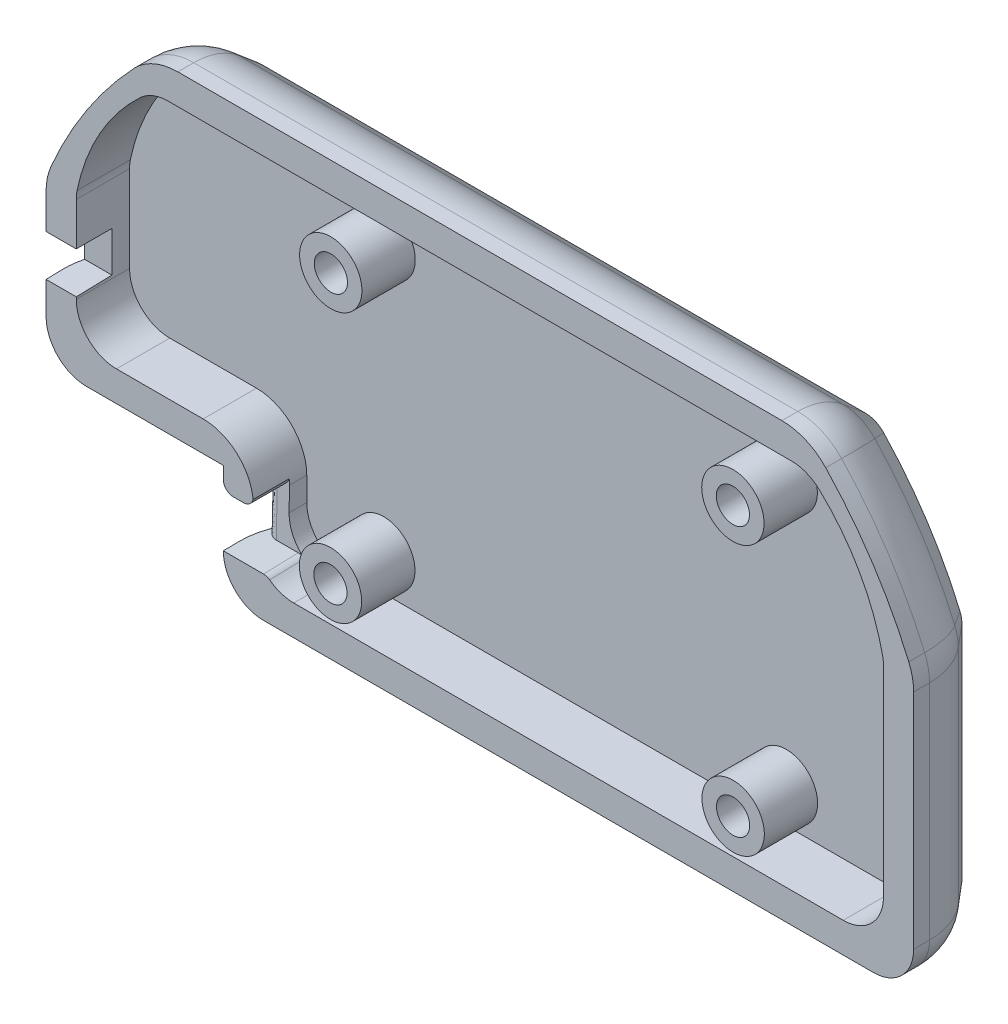
from build123d import *

# Parameters (mm, degrees)
SALIENTE_EXTRUIR1_DEPTH = 8.3
CORTAR_EXTRUIR1_DEPTH   = 5.3
REDONDEO1_R             = 4
REDONDEO2_R             = 6
CHAFL_N1_SIZE           = 3.5
CHAFL_N1_SIZE2          = 4.171137574079752
REDONDEO3_R             = 7
CROQUIS4_R              = 2.7749999999999995
CORTAR_EXTRUIR2_DEPTH   = 5
CORTAR_EXTRUIR3_DEPTH   = 5
CORTAR_EXTRUIR6_DEPTH   = 7
REDONDEO6_R             = 1
REDONDEO7_R             = 1
REDONDEO8_R             = 5
CROQUIS12_R             = 3.1
CROQUIS12_R_2           = 1.6500000000000001
CROQUIS12_R_3           = 3.100000000000001
CROQUIS12_R_4           = 3.0999999999999983
CROQUIS12_R_5           = 1.6499999999999986
SALIENTE_EXTRUIR4_DEPTH = 5.3


with BuildPart() as part:
    # Croquis2 → Saliente-Extruir1 (new body)
    with BuildSketch(Plane.XY):
        with BuildLine():
            Line((-43.60002882422233, 25.32851333445322), (-43.60002882422233, 41.3129831453771))
            ThreePointArc((-43.60002882422233, 41.3129831453771), (-39.15882671890947, 49.72881165917117), (-32.968819822944845, 56.95613898963953))
            Line((-32.968819822944845, 56.95613898963953), (32.03118017705514, 56.95613898963954))
            ThreePointArc((32.03118017705514, 56.95613898963954), (38.221187073019685, 49.72881165917111), (42.66238917833261, 41.31298314537708))
            Line((42.66238917833261, 41.31298314537708), (42.66238917833261, 25.328513334453227))
            Line((42.66238917833261, 25.328513334453227), (42.66238917833261, 13.978747509763107))
            Line((42.66238917833261, 13.978747509763107), (-25.980028824222327, 13.978747509763107))
            Line((-25.980028824222327, 13.978747509763107), (-25.980028824222327, 25.32851333445322))
            Line((-25.980028824222327, 25.32851333445322), (-43.60002882422233, 25.32851333445322))
        make_face()
    extrude(amount=SALIENTE_EXTRUIR1_DEPTH)

    # Croquis3 → Cortar-Extruir1 (cut)
    with BuildSketch(Plane.XY.offset(8.3)):
        with BuildLine():
            Line((39.66238917833264, 41.31298314537709), (39.66238917833264, 28.328513334453234))
            Line((39.66238917833264, 28.328513334453234), (39.662389178332646, 16.978747509763107))
            Line((39.662389178332646, 16.978747509763107), (-22.980028824222334, 16.978747509763107))
            Line((-22.980028824222334, 16.978747509763107), (-22.980028824222334, 28.32851333445322))
            Line((-22.980028824222334, 28.32851333445322), (-40.60002882422233, 28.32851333445322))
            Line((-40.60002882422233, 28.32851333445322), (-40.60002882422233, 41.312983145377096))
            ThreePointArc((-40.60002882422233, 41.312983145377096), (-37.935033492776, 48.32905057290172), (-32.968819822944845, 53.95613898963953))
            Line((-32.968819822944845, 53.95613898963953), (32.031180177055155, 53.95613898963953))
            ThreePointArc((32.031180177055155, 53.95613898963953), (36.96384212830244, 48.30879928595884), (39.66238917833264, 41.31298314537709))
        make_face()
    extrude(amount=-CORTAR_EXTRUIR1_DEPTH, mode=Mode.SUBTRACT)

    # Redondeo1
    redondeo1_edges = [part.edges().sort_by_distance(p)[0] for p in [
        (42.66238917833261, 13.978747509763107, 4.15),
        (-25.980028824222327, 13.978747509763107, 4.15),
        (-43.60002882422233, 25.32851333445322, 4.15),
        (-40.600028824222335, 41.312983145377096, 5.65),
        (-32.968819822944845, 53.95613898963953, 5.65),
        (32.031180177055155, 53.95613898963953, 5.65),
        (39.66238917833264, 41.31298314537709, 5.65),
        (39.662389178332646, 16.978747509763107, 5.65),
        (-22.980028824222334, 16.978747509763107, 5.65),
        (-40.60002882422233, 28.32851333445322, 5.65),
    ]]
    fillet(redondeo1_edges, radius=REDONDEO1_R)

    # Redondeo2
    redondeo2_edges = [part.edges().sort_by_distance(p)[0] for p in [
        (-43.60002882422232, 41.3129831453771, 4.15),
        (-32.968819822944845, 56.95613898963953, 4.15),
        (32.03118017705515, 56.95613898963954, 4.15),
        (42.66238917833262, 41.31298314537708, 4.15),
    ]]
    fillet(redondeo2_edges, radius=REDONDEO2_R)

    # Chaflán1
    chafl_n1_edges = [part.edges().sort_by_distance(p)[0] for p in [
        (-43.60002882422233, 34.7304792672991, 0),
        (-39.54517093838679, 49.15027772348755, 0),
        (-0.4688198229448801, 56.956138989639534, 0),
        (38.60753129249703, 49.15027772348748, 0),
        (31.934382705974894, 56.466674388389215, 0),
        (42.540408198549784, 41.33614466345175, 0),
        (-32.8720223518646, 56.46667438838922, 0),
        (-43.4780478444395, 41.33614466345178, 0),
        (42.66238917833262, 29.055596354954005, 0),
        (8.341180177055143, 13.978747509763107, 0),
        (-32.790028824222325, 25.32851333445322, 0),
        (-42.42845594896852, 26.50008620970703, 0),
        (-24.808455948968515, 15.150320385016917, 0),
        (41.4908163030788, 15.150320385016917, 0),
        (-25.980028824222327, 21.653630422108165, 0),
    ]]
    chafl_n1_side = [part.faces().sort_by_distance(p)[0] for p in [
        (1.6017428435837653, 35.75536833842062, 0),
    ]]
    chamfer(chafl_n1_edges, length=CHAFL_N1_SIZE, length2=CHAFL_N1_SIZE2, reference=chafl_n1_side[0])

    # Redondeo3
    # the kernel refuses this fillet: 7 mm, written as the material it takes off along each edge
    with BuildSketch(Plane(origin=(29.56077793282357, 50.95613898963954, 4.171137574079752), x_dir=(-5.9e-16, 1, 0), z_dir=(-1, -5.9e-16, 0))) as redondeo3_piece_1:
        with BuildLine():
            CenterArc((6 - REDONDEO3_R, -REDONDEO3_R * 0.363970234266), REDONDEO3_R, 0, 39.99999999999985)
            Line((6 - REDONDEO3_R * 0.233955556881, REDONDEO3_R * 0.27881737542), (6 - REDONDEO3_R * 0.218634668019, REDONDEO3_R * 0.291673127614))
            Line((6 - REDONDEO3_R * 0.218634668019, REDONDEO3_R * 0.291673127614), (6 + REDONDEO3_R * 0.02, REDONDEO3_R * 0.00727940468532))
            Line((6 + REDONDEO3_R * 0.02, REDONDEO3_R * 0.00727940468532), (6 + REDONDEO3_R * 0.02, -REDONDEO3_R * 0.363970234266))
            Line((6 + REDONDEO3_R * 0.02, -REDONDEO3_R * 0.363970234266), (6, -REDONDEO3_R * 0.363970234266))
        make_face()
    revolve(axis=Axis((29.56077793282357, 50.95613898963954, 4.171137574079752), (0, 0, -1)), revolution_arc=46.60689881197427, mode=Mode.SUBTRACT)
    with BuildSketch(Plane(origin=(-30.498417578713333, 56.95613898963953, 4.171137574079752), x_dir=(0, 0, 1), z_dir=(1, 2.2e-16, 0))) as redondeo3_piece_2:
        with BuildLine():
            CenterArc((REDONDEO3_R * 0.363970234266, REDONDEO3_R), REDONDEO3_R, 230.00000000000014, 39.999999999999886)
            Line((-REDONDEO3_R * 0.27881737542, REDONDEO3_R * 0.233955556881), (-REDONDEO3_R * 0.291673127614, REDONDEO3_R * 0.218634668019))
            Line((-REDONDEO3_R * 0.291673127614, REDONDEO3_R * 0.218634668019), (-REDONDEO3_R * 0.00727940468532, -REDONDEO3_R * 0.02))
            Line((-REDONDEO3_R * 0.00727940468532, -REDONDEO3_R * 0.02), (REDONDEO3_R * 0.363970234266, -REDONDEO3_R * 0.02))
            Line((REDONDEO3_R * 0.363970234266, -REDONDEO3_R * 0.02), (REDONDEO3_R * 0.363970234266, 0))
        make_face()
    extrude(amount=60.0591955115369, mode=Mode.SUBTRACT)
    with BuildSketch(Plane(origin=(-30.49841757871333, 50.95613898963953, 4.171137574079752), x_dir=(-0.726657395838407, 0.6870000211596391, 0), z_dir=(-0.6870000211596391, -0.726657395838407, 0))) as redondeo3_piece_3:
        with BuildLine():
            CenterArc((6.000000000000003 - REDONDEO3_R, -REDONDEO3_R * 0.363970234266), REDONDEO3_R, 0, 39.99999999999994)
            Line((6.000000000000003 - REDONDEO3_R * 0.233955556881, REDONDEO3_R * 0.27881737542), (6.000000000000003 - REDONDEO3_R * 0.218634668019, REDONDEO3_R * 0.291673127614))
            Line((6.000000000000003 - REDONDEO3_R * 0.218634668019, REDONDEO3_R * 0.291673127614), (6.000000000000003 + REDONDEO3_R * 0.02, REDONDEO3_R * 0.00727940468532))
            Line((6.000000000000003 + REDONDEO3_R * 0.02, REDONDEO3_R * 0.00727940468532), (6.000000000000003 + REDONDEO3_R * 0.02, -REDONDEO3_R * 0.363970234266))
            Line((6.000000000000003 + REDONDEO3_R * 0.02, -REDONDEO3_R * 0.363970234266), (6.000000000000003, -REDONDEO3_R * 0.363970234266))
        make_face()
    revolve(axis=Axis((-30.49841757871333, 50.95613898963953, 4.171137574079752), (0, 0, -1)), revolution_arc=46.60689881197317, mode=Mode.SUBTRACT)
    with BuildSketch(Plane(origin=(-3.7394013650729256, 25.657497827704482, 4.171137574079752), x_dir=(-0.9195059778908293, 0.39307601888569815, 0), z_dir=(-0.39307601888569815, -0.9195059778908293, 0))) as redondeo3_piece_4:
        with BuildLine():
            CenterArc((42.82480405056114 - REDONDEO3_R, -REDONDEO3_R * 0.363970234266), REDONDEO3_R, 0, 39.99999999999993)
            Line((42.82480405056114 - REDONDEO3_R * 0.233955556881, REDONDEO3_R * 0.27881737542), (42.82480405056114 - REDONDEO3_R * 0.218634668019, REDONDEO3_R * 0.291673127614))
            Line((42.82480405056114 - REDONDEO3_R * 0.218634668019, REDONDEO3_R * 0.291673127614), (42.82480405056114 + REDONDEO3_R * 0.02, REDONDEO3_R * 0.00727940468532))
            Line((42.82480405056114 + REDONDEO3_R * 0.02, REDONDEO3_R * 0.00727940468532), (42.82480405056114 + REDONDEO3_R * 0.02, -REDONDEO3_R * 0.363970234266))
            Line((42.82480405056114 + REDONDEO3_R * 0.02, -REDONDEO3_R * 0.363970234266), (42.82480405056114, -REDONDEO3_R * 0.363970234266))
        make_face()
    revolve(axis=Axis((-3.7394013650729256, 25.657497827704482, 4.171137574079752), (0, 0, -1)), revolution_arc=20.24706699288521, mode=Mode.SUBTRACT)
    with BuildSketch(Plane(origin=(-37.60002882422232, 40.132445200144986, 4.171137574079752), x_dir=(-1, 0, 0), z_dir=(0, -1, 0))) as redondeo3_piece_5:
        with BuildLine():
            CenterArc((6 - REDONDEO3_R, -REDONDEO3_R * 0.363970234266), REDONDEO3_R, 0, 39.99999999999985)
            Line((6 - REDONDEO3_R * 0.233955556881, REDONDEO3_R * 0.27881737542), (6 - REDONDEO3_R * 0.218634668019, REDONDEO3_R * 0.291673127614))
            Line((6 - REDONDEO3_R * 0.218634668019, REDONDEO3_R * 0.291673127614), (6 + REDONDEO3_R * 0.02, REDONDEO3_R * 0.00727940468532))
            Line((6 + REDONDEO3_R * 0.02, REDONDEO3_R * 0.00727940468532), (6 + REDONDEO3_R * 0.02, -REDONDEO3_R * 0.363970234266))
            Line((6 + REDONDEO3_R * 0.02, -REDONDEO3_R * 0.363970234266), (6, -REDONDEO3_R * 0.363970234266))
        make_face()
    revolve(axis=Axis((-37.60002882422232, 40.132445200144986, 4.171137574079752), (0, 0, -1)), revolution_arc=23.146034195141592, mode=Mode.SUBTRACT)
    with BuildSketch(Plane(origin=(-43.60002882422233, 29.32851333445322, 4.171137574079752), x_dir=(0, 0, 1), z_dir=(0, 1, 0))) as redondeo3_piece_6:
        with BuildLine():
            CenterArc((REDONDEO3_R * 0.363970234266, REDONDEO3_R), REDONDEO3_R, 230.00000000000009, 39.999999999999886)
            Line((-REDONDEO3_R * 0.27881737542, REDONDEO3_R * 0.233955556881), (-REDONDEO3_R * 0.291673127614, REDONDEO3_R * 0.218634668019))
            Line((-REDONDEO3_R * 0.291673127614, REDONDEO3_R * 0.218634668019), (-REDONDEO3_R * 0.00727940468532, -REDONDEO3_R * 0.02))
            Line((-REDONDEO3_R * 0.00727940468532, -REDONDEO3_R * 0.02), (REDONDEO3_R * 0.363970234266, -REDONDEO3_R * 0.02))
            Line((REDONDEO3_R * 0.363970234266, -REDONDEO3_R * 0.02), (REDONDEO3_R * 0.363970234266, 0))
        make_face()
    extrude(amount=10.803931865691766, mode=Mode.SUBTRACT)
    with BuildSketch(Plane(origin=(-39.60002882422233, 29.32851333445322, 4.171137574079752), x_dir=(0, -1, 0), z_dir=(1, 0, 0))) as redondeo3_piece_7:
        with BuildLine():
            CenterArc((4 - REDONDEO3_R, -REDONDEO3_R * 0.363970234266), REDONDEO3_R, 0, 39.999999999999886)
            Line((4 - REDONDEO3_R * 0.233955556881, REDONDEO3_R * 0.27881737542), (4 - REDONDEO3_R * 0.218634668019, REDONDEO3_R * 0.291673127614))
            Line((4 - REDONDEO3_R * 0.218634668019, REDONDEO3_R * 0.291673127614), (4 + REDONDEO3_R * 0.02, REDONDEO3_R * 0.00727940468532))
            Line((4 + REDONDEO3_R * 0.02, REDONDEO3_R * 0.00727940468532), (4 + REDONDEO3_R * 0.02, -REDONDEO3_R * 0.363970234266))
            Line((4 + REDONDEO3_R * 0.02, -REDONDEO3_R * 0.363970234266), (4, -REDONDEO3_R * 0.363970234266))
        make_face()
    revolve(axis=Axis((-39.60002882422233, 29.32851333445322, 4.171137574079752), (0, 0, -1)), revolution_arc=90, mode=Mode.SUBTRACT)
    with BuildSketch(Plane(origin=(-23.432237184358918, 25.32851333445322, 4.171137574079753), x_dir=(0, 0, 1), z_dir=(-1, 0, 0))) as redondeo3_piece_8_section:
        with BuildLine():
            CenterArc((REDONDEO3_R * 0.363970234266, REDONDEO3_R), REDONDEO3_R, 230.00000000000009, 39.999999999999886)
            Line((-REDONDEO3_R * 0.27881737542, REDONDEO3_R * 0.233955556881), (-REDONDEO3_R * 0.291673127614, REDONDEO3_R * 0.218634668019))
            Line((-REDONDEO3_R * 0.291673127614, REDONDEO3_R * 0.218634668019), (-REDONDEO3_R * 0.00727940468532, -REDONDEO3_R * 0.02))
            Line((-REDONDEO3_R * 0.00727940468532, -REDONDEO3_R * 0.02), (REDONDEO3_R * 0.363970234266, -REDONDEO3_R * 0.02))
            Line((REDONDEO3_R * 0.363970234266, -REDONDEO3_R * 0.02), (REDONDEO3_R * 0.363970234266, 0))
        make_face()
    redondeo3_piece_8 = extrude(amount=16.16779163986341, mode=Mode.PRIVATE)
    redondeo3_piece_8 = split(redondeo3_piece_8, bisect_by=Plane(origin=(-25.980028824222327, 26.27329503327853, 3.0060445032906005), z_dir=(1, 0, 0)), keep=Keep.TOP, mode=Mode.PRIVATE)
    redondeo3_piece_8 = split(redondeo3_piece_8, bisect_by=Plane(origin=(-25.204366068883004, 26.27329503327853, 3.2467386987625857), z_dir=(-0.7660444431189793, 0, -0.6427876096865378)), keep=Keep.TOP, mode=Mode.PRIVATE)
    add(redondeo3_piece_8, mode=Mode.SUBTRACT)
    with BuildSketch(Plane(origin=(-25.980028824222327, 25.32851333445322, 4.171137574079752), x_dir=(0, 0, 1), z_dir=(-1, 0, 0))) as redondeo3_piece_9_section:
        with BuildLine():
            CenterArc((REDONDEO3_R * 0.363970234266, REDONDEO3_R), REDONDEO3_R, 230.00000000000009, 39.999999999999886)
            Line((-REDONDEO3_R * 0.27881737542, REDONDEO3_R * 0.233955556881), (-REDONDEO3_R * 0.291673127614, REDONDEO3_R * 0.218634668019))
            Line((-REDONDEO3_R * 0.291673127614, REDONDEO3_R * 0.218634668019), (-REDONDEO3_R * 0.00727940468532, -REDONDEO3_R * 0.02))
            Line((-REDONDEO3_R * 0.00727940468532, -REDONDEO3_R * 0.02), (REDONDEO3_R * 0.363970234266, -REDONDEO3_R * 0.02))
            Line((REDONDEO3_R * 0.363970234266, -REDONDEO3_R * 0.02), (REDONDEO3_R * 0.363970234266, 0))
        make_face()
    redondeo3_piece_9 = extrude(amount=13.620000000000001, mode=Mode.PRIVATE)
    redondeo3_piece_9 = split(redondeo3_piece_9, bisect_by=Plane(origin=(-26.947574554728, 25.317678328783646, 5.324213674409082), z_dir=(0.7660444431189793, 0, 0.6427876096865378)), keep=Keep.TOP, mode=Mode.PRIVATE)
    add(redondeo3_piece_9, mode=Mode.SUBTRACT)
    with BuildSketch(Plane(origin=(-25.980028824222327, 25.32851333445322, 4.171137574079752), x_dir=(0, 0, 1), z_dir=(-1, 0, 0))) as redondeo3_piece_10_section:
        with BuildLine():
            CenterArc((REDONDEO3_R * 0.363970234266, REDONDEO3_R), REDONDEO3_R, 230.00000000000009, 39.999999999999886)
            Line((-REDONDEO3_R * 0.27881737542, REDONDEO3_R * 0.233955556881), (-REDONDEO3_R * 0.291673127614, REDONDEO3_R * 0.218634668019))
            Line((-REDONDEO3_R * 0.291673127614, REDONDEO3_R * 0.218634668019), (-REDONDEO3_R * 0.00727940468532, -REDONDEO3_R * 0.02))
            Line((-REDONDEO3_R * 0.00727940468532, -REDONDEO3_R * 0.02), (REDONDEO3_R * 0.363970234266, -REDONDEO3_R * 0.02))
            Line((REDONDEO3_R * 0.363970234266, -REDONDEO3_R * 0.02), (REDONDEO3_R * 0.363970234266, 0))
        make_face()
    redondeo3_piece_10 = extrude(amount=13.620000000000001, mode=Mode.PRIVATE)
    redondeo3_piece_10 = split(redondeo3_piece_10, bisect_by=Plane(origin=(-28.91365303284747, 25.67823870114554, 7.667294764030126), z_dir=(-0.7660444431189793, 0, -0.6427876096865378)), keep=Keep.TOP, mode=Mode.PRIVATE)
    add(redondeo3_piece_10, mode=Mode.SUBTRACT)
    with BuildSketch(Plane(origin=(-25.980028824222327, 17.978747509763107, 4.171137574079752), x_dir=(0, 0, 1), z_dir=(0, 1, 0))) as redondeo3_piece_11_section:
        with BuildLine():
            CenterArc((REDONDEO3_R * 0.363970234266, REDONDEO3_R), REDONDEO3_R, 230.0000000000001, 39.999999999999886)
            Line((-REDONDEO3_R * 0.27881737542, REDONDEO3_R * 0.233955556881), (-REDONDEO3_R * 0.291673127614, REDONDEO3_R * 0.218634668019))
            Line((-REDONDEO3_R * 0.291673127614, REDONDEO3_R * 0.218634668019), (-REDONDEO3_R * 0.00727940468532, -REDONDEO3_R * 0.02))
            Line((-REDONDEO3_R * 0.00727940468532, -REDONDEO3_R * 0.02), (REDONDEO3_R * 0.363970234266, -REDONDEO3_R * 0.02))
            Line((REDONDEO3_R * 0.363970234266, -REDONDEO3_R * 0.02), (REDONDEO3_R * 0.363970234266, 0))
        make_face()
    redondeo3_piece_11 = extrude(amount=7.349765824690113, mode=Mode.PRIVATE)
    redondeo3_piece_11 = split(redondeo3_piece_11, bisect_by=Plane(origin=(-25.62050052509104, 23.713289919136134, 6.096085882126184), z_dir=(0, -0.7660444431189793, -0.6427876096865378)), keep=Keep.TOP, mode=Mode.PRIVATE)
    add(redondeo3_piece_11, mode=Mode.SUBTRACT)
    with BuildSketch(Plane(origin=(-25.980028824222327, 17.978747509763107, 4.171137574079752), x_dir=(0, 0, 1), z_dir=(0, 1, 0))) as redondeo3_piece_12_section:
        with BuildLine():
            CenterArc((REDONDEO3_R * 0.363970234266, REDONDEO3_R), REDONDEO3_R, 230.0000000000001, 39.999999999999886)
            Line((-REDONDEO3_R * 0.27881737542, REDONDEO3_R * 0.233955556881), (-REDONDEO3_R * 0.291673127614, REDONDEO3_R * 0.218634668019))
            Line((-REDONDEO3_R * 0.291673127614, REDONDEO3_R * 0.218634668019), (-REDONDEO3_R * 0.00727940468532, -REDONDEO3_R * 0.02))
            Line((-REDONDEO3_R * 0.00727940468532, -REDONDEO3_R * 0.02), (REDONDEO3_R * 0.363970234266, -REDONDEO3_R * 0.02))
            Line((REDONDEO3_R * 0.363970234266, -REDONDEO3_R * 0.02), (REDONDEO3_R * 0.363970234266, 0))
        make_face()
    redondeo3_piece_12 = extrude(amount=9.897557464553522, mode=Mode.PRIVATE)
    redondeo3_piece_12 = split(redondeo3_piece_12, bisect_by=Plane(origin=(-25.035247125397017, 25.32851333445322, 3.006044503290602), z_dir=(0, 1, 0)), keep=Keep.TOP, mode=Mode.PRIVATE)
    redondeo3_piece_12 = split(redondeo3_piece_12, bisect_by=Plane(origin=(-25.035247125397017, 26.10417608979254, 3.246738698762591), z_dir=(0, -0.7660444431189793, -0.6427876096865378)), keep=Keep.TOP, mode=Mode.PRIVATE)
    add(redondeo3_piece_12, mode=Mode.SUBTRACT)
    with BuildSketch(Plane(origin=(-25.980028824222327, 17.978747509763107, 4.171137574079752), x_dir=(0, 0, 1), z_dir=(0, 1, 0))) as redondeo3_piece_13_section:
        with BuildLine():
            CenterArc((REDONDEO3_R * 0.363970234266, REDONDEO3_R), REDONDEO3_R, 230.0000000000001, 39.999999999999886)
            Line((-REDONDEO3_R * 0.27881737542, REDONDEO3_R * 0.233955556881), (-REDONDEO3_R * 0.291673127614, REDONDEO3_R * 0.218634668019))
            Line((-REDONDEO3_R * 0.291673127614, REDONDEO3_R * 0.218634668019), (-REDONDEO3_R * 0.00727940468532, -REDONDEO3_R * 0.02))
            Line((-REDONDEO3_R * 0.00727940468532, -REDONDEO3_R * 0.02), (REDONDEO3_R * 0.363970234266, -REDONDEO3_R * 0.02))
            Line((REDONDEO3_R * 0.363970234266, -REDONDEO3_R * 0.02), (REDONDEO3_R * 0.363970234266, 0))
        make_face()
    redondeo3_piece_13 = extrude(amount=7.349765824690113, mode=Mode.PRIVATE)
    redondeo3_piece_13 = split(redondeo3_piece_13, bisect_by=Plane(origin=(-25.990863829891904, 24.360967603947547, 5.32421367440908), z_dir=(0, 0.7660444431189793, 0.6427876096865378)), keep=Keep.TOP, mode=Mode.PRIVATE)
    add(redondeo3_piece_13, mode=Mode.SUBTRACT)
    with BuildSketch(Plane(origin=(-21.980028824222323, 17.978747509763107, 4.171137574079752), x_dir=(0, -1, 0), z_dir=(1, 0, 0))) as redondeo3_piece_14:
        with BuildLine():
            CenterArc((4 - REDONDEO3_R, -REDONDEO3_R * 0.363970234266), REDONDEO3_R, 0, 39.999999999999886)
            Line((4 - REDONDEO3_R * 0.233955556881, REDONDEO3_R * 0.27881737542), (4 - REDONDEO3_R * 0.218634668019, REDONDEO3_R * 0.291673127614))
            Line((4 - REDONDEO3_R * 0.218634668019, REDONDEO3_R * 0.291673127614), (4 + REDONDEO3_R * 0.02, REDONDEO3_R * 0.00727940468532))
            Line((4 + REDONDEO3_R * 0.02, REDONDEO3_R * 0.00727940468532), (4 + REDONDEO3_R * 0.02, -REDONDEO3_R * 0.363970234266))
            Line((4 + REDONDEO3_R * 0.02, -REDONDEO3_R * 0.363970234266), (4, -REDONDEO3_R * 0.363970234266))
        make_face()
    revolve(axis=Axis((-21.980028824222323, 17.978747509763107, 4.171137574079752), (0, 0, -1)), revolution_arc=90, mode=Mode.SUBTRACT)
    with BuildSketch(Plane(origin=(38.66238917833261, 13.978747509763107, 4.171137574079752), x_dir=(0, 0, 1), z_dir=(-1, 0, 0))) as redondeo3_piece_15:
        with BuildLine():
            CenterArc((REDONDEO3_R * 0.363970234266, REDONDEO3_R), REDONDEO3_R, 230.0000000000001, 39.999999999999886)
            Line((-REDONDEO3_R * 0.27881737542, REDONDEO3_R * 0.233955556881), (-REDONDEO3_R * 0.291673127614, REDONDEO3_R * 0.218634668019))
            Line((-REDONDEO3_R * 0.291673127614, REDONDEO3_R * 0.218634668019), (-REDONDEO3_R * 0.00727940468532, -REDONDEO3_R * 0.02))
            Line((-REDONDEO3_R * 0.00727940468532, -REDONDEO3_R * 0.02), (REDONDEO3_R * 0.363970234266, -REDONDEO3_R * 0.02))
            Line((REDONDEO3_R * 0.363970234266, -REDONDEO3_R * 0.02), (REDONDEO3_R * 0.363970234266, 0))
        make_face()
    extrude(amount=60.64241800255493, mode=Mode.SUBTRACT)
    with BuildSketch(Plane(origin=(38.66238917833261, 17.978747509763107, 4.171137574079752), x_dir=(1, 0, 0), z_dir=(0, 1, 0))) as redondeo3_piece_16:
        with BuildLine():
            CenterArc((4 - REDONDEO3_R, -REDONDEO3_R * 0.363970234266), REDONDEO3_R, 0, 39.99999999999993)
            Line((4 - REDONDEO3_R * 0.233955556881, REDONDEO3_R * 0.27881737542), (4 - REDONDEO3_R * 0.218634668019, REDONDEO3_R * 0.291673127614))
            Line((4 - REDONDEO3_R * 0.218634668019, REDONDEO3_R * 0.291673127614), (4 + REDONDEO3_R * 0.02, REDONDEO3_R * 0.00727940468532))
            Line((4 + REDONDEO3_R * 0.02, REDONDEO3_R * 0.00727940468532), (4 + REDONDEO3_R * 0.02, -REDONDEO3_R * 0.363970234266))
            Line((4 + REDONDEO3_R * 0.02, -REDONDEO3_R * 0.363970234266), (4, -REDONDEO3_R * 0.363970234266))
        make_face()
    revolve(axis=Axis((38.66238917833261, 17.978747509763107, 4.171137574079752), (0, 0, -1)), revolution_arc=90, mode=Mode.SUBTRACT)
    with BuildSketch(Plane(origin=(42.66238917833261, 40.1324452001449, 4.171137574079752), x_dir=(0, 0, 1), z_dir=(-2.6e-16, -1, 0))) as redondeo3_piece_17:
        with BuildLine():
            CenterArc((REDONDEO3_R * 0.363970234266, REDONDEO3_R), REDONDEO3_R, 230.00000000000009, 39.999999999999886)
            Line((-REDONDEO3_R * 0.27881737542, REDONDEO3_R * 0.233955556881), (-REDONDEO3_R * 0.291673127614, REDONDEO3_R * 0.218634668019))
            Line((-REDONDEO3_R * 0.291673127614, REDONDEO3_R * 0.218634668019), (-REDONDEO3_R * 0.00727940468532, -REDONDEO3_R * 0.02))
            Line((-REDONDEO3_R * 0.00727940468532, -REDONDEO3_R * 0.02), (REDONDEO3_R * 0.363970234266, -REDONDEO3_R * 0.02))
            Line((REDONDEO3_R * 0.363970234266, -REDONDEO3_R * 0.02), (REDONDEO3_R * 0.363970234266, 0))
        make_face()
    extrude(amount=22.153697690381794, mode=Mode.SUBTRACT)
    with BuildSketch(Plane(origin=(36.66238917833262, 40.1324452001449, 4.171137574079752), x_dir=(0.9195059778908227, 0.39307601888571375, 0), z_dir=(-0.39307601888571375, 0.9195059778908227, 0))) as redondeo3_piece_18:
        with BuildLine():
            CenterArc((6.000000000000002 - REDONDEO3_R, -REDONDEO3_R * 0.363970234266), REDONDEO3_R, 0, 39.999999999999886)
            Line((6.000000000000002 - REDONDEO3_R * 0.233955556881, REDONDEO3_R * 0.27881737542), (6.000000000000002 - REDONDEO3_R * 0.218634668019, REDONDEO3_R * 0.291673127614))
            Line((6.000000000000002 - REDONDEO3_R * 0.218634668019, REDONDEO3_R * 0.291673127614), (6.000000000000002 + REDONDEO3_R * 0.02, REDONDEO3_R * 0.00727940468532))
            Line((6.000000000000002 + REDONDEO3_R * 0.02, REDONDEO3_R * 0.00727940468532), (6.000000000000002 + REDONDEO3_R * 0.02, -REDONDEO3_R * 0.363970234266))
            Line((6.000000000000002 + REDONDEO3_R * 0.02, -REDONDEO3_R * 0.363970234266), (6.000000000000002, -REDONDEO3_R * 0.363970234266))
        make_face()
    revolve(axis=Axis((36.66238917833262, 40.1324452001449, 4.171137574079752), (0, 0, -1)), revolution_arc=23.146034195142526, mode=Mode.SUBTRACT)
    with BuildSketch(Plane(origin=(2.8017617191798188, 25.65749782770225, 4.171137574079752), x_dir=(0.72665739583842, 0.6870000211596253, 0), z_dir=(-0.6870000211596253, 0.72665739583842, 0))) as redondeo3_piece_19:
        with BuildLine():
            CenterArc((42.82480405056512 - REDONDEO3_R, -REDONDEO3_R * 0.363970234266), REDONDEO3_R, 0, 39.99999999999993)
            Line((42.82480405056512 - REDONDEO3_R * 0.233955556881, REDONDEO3_R * 0.27881737542), (42.82480405056512 - REDONDEO3_R * 0.218634668019, REDONDEO3_R * 0.291673127614))
            Line((42.82480405056512 - REDONDEO3_R * 0.218634668019, REDONDEO3_R * 0.291673127614), (42.82480405056512 + REDONDEO3_R * 0.02, REDONDEO3_R * 0.00727940468532))
            Line((42.82480405056512 + REDONDEO3_R * 0.02, REDONDEO3_R * 0.00727940468532), (42.82480405056512 + REDONDEO3_R * 0.02, -REDONDEO3_R * 0.363970234266))
            Line((42.82480405056512 + REDONDEO3_R * 0.02, -REDONDEO3_R * 0.363970234266), (42.82480405056511, -REDONDEO3_R * 0.363970234266))
        make_face()
    revolve(axis=Axis((2.8017617191798188, 25.65749782770225, 4.171137574079752), (0, 0, -1)), revolution_arc=20.24706699288318, mode=Mode.SUBTRACT)
    with BuildSketch(Plane(origin=(-23.432237184358918, 25.32851333445322, 4.171137574079753), x_dir=(0, 0, 1), z_dir=(-1, 0, 0))) as redondeo3_piece_20a_section:
        with BuildLine():
            CenterArc((REDONDEO3_R * 0.363970234266, REDONDEO3_R), REDONDEO3_R, 230.00000000000009, 39.999999999999886)
            Line((-REDONDEO3_R * 0.27881737542, REDONDEO3_R * 0.233955556881), (-REDONDEO3_R * 0.291673127614, REDONDEO3_R * 0.218634668019))
            Line((-REDONDEO3_R * 0.291673127614, REDONDEO3_R * 0.218634668019), (-REDONDEO3_R * 0.00727940468532, -REDONDEO3_R * 0.02))
            Line((-REDONDEO3_R * 0.00727940468532, -REDONDEO3_R * 0.02), (REDONDEO3_R * 0.363970234266, -REDONDEO3_R * 0.02))
            Line((REDONDEO3_R * 0.363970234266, -REDONDEO3_R * 0.02), (REDONDEO3_R * 0.363970234266, 0))
        make_face()
    redondeo3_piece_20a = extrude(amount=16.16779163986341, mode=Mode.PRIVATE)
    redondeo3_piece_20a = split(redondeo3_piece_20a, bisect_by=Plane(origin=(-25.980028824222327, 25.584574589836716, 4.470578982051864), z_dir=(1, 0, 0)), keep=Keep.TOP, mode=Mode.PRIVATE)
    redondeo3_piece_20a = split(redondeo3_piece_20a, bisect_by=Plane(origin=(-25.55679663997047, 25.584574589836716, 3.666749097996106), z_dir=(0.7660444431189793, 0, 0.6427876096865378)), keep=Keep.TOP, mode=Mode.PRIVATE)
    with BuildSketch(Plane(origin=(-25.980028824222327, 17.978747509763107, 4.171137574079752), x_dir=(0, 0, 1), z_dir=(0, 1, 0))) as redondeo3_piece_20b_section:
        with BuildLine():
            CenterArc((REDONDEO3_R * 0.363970234266, REDONDEO3_R), REDONDEO3_R, 230.0000000000001, 39.999999999999886)
            Line((-REDONDEO3_R * 0.27881737542, REDONDEO3_R * 0.233955556881), (-REDONDEO3_R * 0.291673127614, REDONDEO3_R * 0.218634668019))
            Line((-REDONDEO3_R * 0.291673127614, REDONDEO3_R * 0.218634668019), (-REDONDEO3_R * 0.00727940468532, -REDONDEO3_R * 0.02))
            Line((-REDONDEO3_R * 0.00727940468532, -REDONDEO3_R * 0.02), (REDONDEO3_R * 0.363970234266, -REDONDEO3_R * 0.02))
            Line((REDONDEO3_R * 0.363970234266, -REDONDEO3_R * 0.02), (REDONDEO3_R * 0.363970234266, 0))
        make_face()
    redondeo3_piece_20b = extrude(amount=9.897557464553522, mode=Mode.PRIVATE)
    redondeo3_piece_20b = split(redondeo3_piece_20b, bisect_by=Plane(origin=(-25.72396756883883, 25.32851333445322, 4.470578982051859), z_dir=(0, 1, 0)), keep=Keep.TOP, mode=Mode.PRIVATE)
    redondeo3_piece_20b = split(redondeo3_piece_20b, bisect_by=Plane(origin=(-25.72396756883883, 25.751745518705082, 3.6667490979960977), z_dir=(0, 0.7660444431189793, 0.6427876096865378)), keep=Keep.TOP, mode=Mode.PRIVATE)
    redondeo3_piece_20 = redondeo3_piece_20a & redondeo3_piece_20b
    add(redondeo3_piece_20, mode=Mode.SUBTRACT)

    # Croquis4 → Cortar-Extruir2 (cut)
    with BuildSketch(Plane(origin=(0, 0, 0), x_dir=(-1, 0, 0), z_dir=(0, 0, -1))):
        with Locations((-24.705207538108994, 47.20775754804015)):
            Circle(CROQUIS4_R)
        with Locations((15.294792461891006, 47.22174234703974)):
            Circle(CROQUIS4_R)
        with Locations((-24.700915305668662, 20.456980413473676)):
            Circle(CROQUIS4_R)
        with Locations((15.299571523338239, 20.47174234703974)):
            Circle(CROQUIS4_R)
    extrude(amount=-CORTAR_EXTRUIR2_DEPTH, mode=Mode.SUBTRACT)

    # Croquis8 → Cortar-Extruir3 (cut)
    with BuildSketch(Plane.ZY.offset(43.60002882422233)):
        Polygon((8.58368014960684, 36.65587319794517), (8.58368014960684, 32.52650142454986), (4.752369792279609, 32.63109930385631), (4.752369792279609, 36.65587319794517), align=None)
    extrude(amount=-CORTAR_EXTRUIR3_DEPTH, mode=Mode.SUBTRACT)

    # Croquis9 → Cortar-Extruir6 (cut)
    with BuildSketch(Plane.ZY.offset(25.980028824222327)):
        Polygon((8.408836195642264, 23.117808174556277), (8.408836195642264, 17.973297172424886), (4.793527875893386, 18.02118205083216), (4.727122323792746, 23.117808174556277), align=None)
    extrude(amount=-CORTAR_EXTRUIR6_DEPTH, mode=Mode.SUBTRACT)

    # Redondeo6
    redondeo6_edges = [part.edges().sort_by_distance(p)[0] for p in [
        (-25.907311422707075, 23.117808174556277, 5.712571523691718),
        (-22.980028824222334, 23.117808174556277, 6.513561161896373),
        (-21.64740728034355, 17.99796033657875, 6.546767302025188),
        (-25.980028824222327, 23.117808174556277, 7.509464606971),
    ]]
    fillet(redondeo6_edges, radius=REDONDEO6_R)

    # Redondeo7
    redondeo7_edges = [part.edges().sort_by_distance(p)[0] for p in [
        (-25.700435799025755, 20.56949545055167, 4.760325095441015),
    ]]
    fillet(redondeo7_edges, radius=REDONDEO7_R)

    # Redondeo8
    # the kernel refuses this fillet: 5 mm, written as the material it takes off along each edge
    with BuildSketch(Plane(origin=(-22.980028824222334, 28.32851333445322, 20.8), x_dir=(0, -1, 0), z_dir=(0, 0, -1))) as redondeo8_piece_1:
        with BuildLine():
            CenterArc((REDONDEO8_R, REDONDEO8_R), REDONDEO8_R, 180, 90)
            Line((0, REDONDEO8_R), (0, 0))
            Line((0, 0), (REDONDEO8_R, 0))
        make_face()
    extrude(amount=17.8, mode=Mode.SUBTRACT)

    # Croquis12 → Saliente-Extruir4 (add)
    # profile 1 of 4: a face of its own
    with BuildSketch(Plane.XY.offset(3)):
        with Locations(Location((-15.29418490969109, 47.264087579024924, 0), (0, 0, 180))):
            Circle(CROQUIS12_R)
        with Locations(Location((-15.281002970711898, 47.2434063732079, 0), (0, 0, 180))):
            Circle(CROQUIS12_R_2, mode=Mode.SUBTRACT)
    # profile 2 of 4: a face of its own
    with BuildSketch(Plane.XY.offset(3)):
        with Locations(Location((-15.318820801305144, 20.491262726407246, 0), (0, 0, 180))):
            Circle(CROQUIS12_R_3)
        with Locations(Location((-15.32727172135038, 20.47436088631677, 0), (0, 0, 180))):
            Circle(CROQUIS12_R_2, mode=Mode.SUBTRACT)
    # profile 3 of 4: a face of its own
    with BuildSketch(Plane.XY.offset(3)):
        with Locations(Location((24.71512613636829, 20.46247416413841, 0), (0, 0, 180))):
            Circle(CROQUIS12_R_4)
        with Locations(Location((24.708830632924766, 20.468769667581935, 0), (0, 0, 180))):
            Circle(CROQUIS12_R_5, mode=Mode.SUBTRACT)
    # profile 4 of 4: a face of its own
    with BuildSketch(Plane.XY.offset(3)):
        with Locations(Location((24.69026484825132, 47.217939462836355, 0), (0, 0, 180))):
            Circle(CROQUIS12_R_4)
        with Locations(Location((24.69026484825132, 47.229734767204945, 0), (0, 0, 180))):
            Circle(CROQUIS12_R_5, mode=Mode.SUBTRACT)
    extrude(amount=SALIENTE_EXTRUIR4_DEPTH)


solid = part.part
